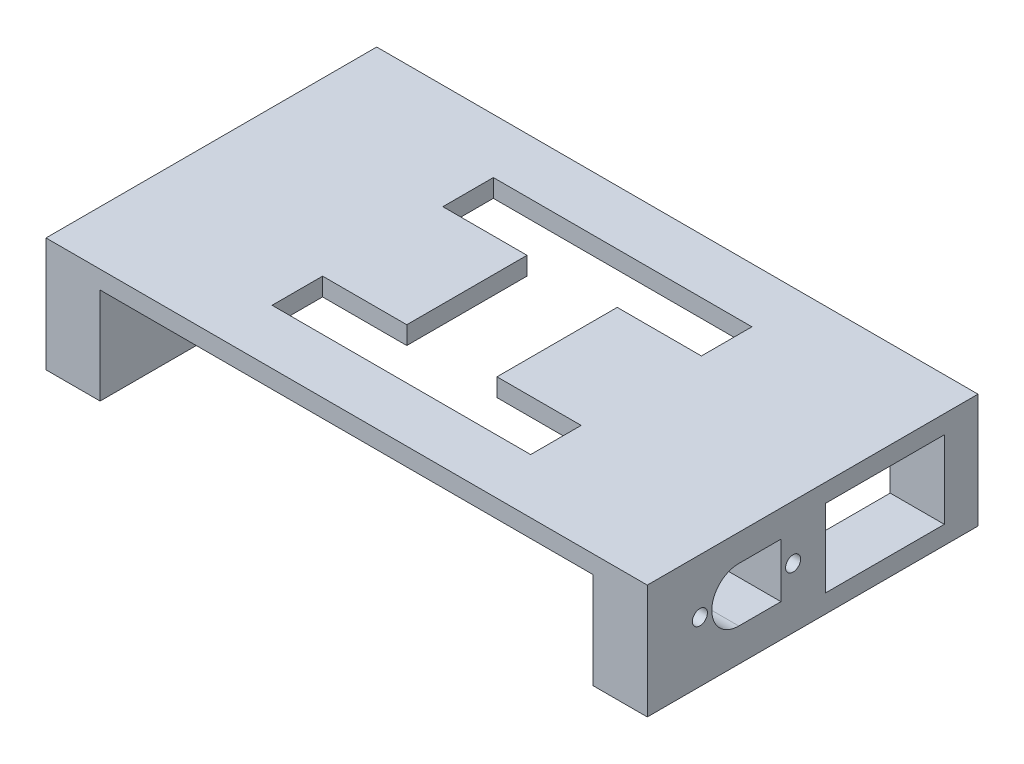
from build123d import *

# Parameters (mm, degrees)
SKETCH1_W           = 100
SKETCH1_H           = 55
BOSS_EXTRUDE1_DEPTH = 19
SKETCH2_W           = 82
SKETCH2_H           = 91
CUT_EXTRUDE1_DEPTH  = 16
CUT_EXTRUDE3_REACH  = 107.438
SKETCH3_R           = 1.25
CUT_EXTRUDE13_REACH = 107.438
SKETCH15_W          = 19.8
SKETCH15_H          = 12.9
CUT_EXTRUDE14_REACH = 62.144
SKETCH6_W           = 43
SKETCH6_H           = 8.4
CUT_EXTRUDE17_REACH = 62.144
SKETCH18_W          = 15
SKETCH18_H          = 20


with BuildPart() as part:
    # Sketch1 → Boss-Extrude1 (new body)
    with BuildSketch(Plane(origin=(0, 0, 0), x_dir=(1, 0, 0), z_dir=(0, 1, 0))):
        Rectangle(SKETCH1_W, SKETCH1_H)
    extrude(amount=BOSS_EXTRUDE1_DEPTH)

    # Sketch2 → Cut-Extrude1 (cut)
    with BuildSketch(Plane.XZ):
        Rectangle(SKETCH2_W, SKETCH2_H)
    extrude(amount=-CUT_EXTRUDE1_DEPTH, mode=Mode.SUBTRACT)

    # Sketch3 → Cut-Extrude3 (cut, up to next)
    with BuildSketch(Plane(origin=(50, 0, 0), x_dir=(0, 0, -1), z_dir=(1, 0, 0)), mode=Mode.PRIVATE) as cut_extrude3_sk1:
        with Locations((-18.75, 10)):
            Circle(SKETCH3_R)
    cut_extrude3_tool1 = extrude(cut_extrude3_sk1.sketch, amount=-CUT_EXTRUDE3_REACH, mode=Mode.PRIVATE) & part.part
    # Sketch3 → Cut-Extrude3 (cut, up to next)
    with BuildSketch(Plane(origin=(50, 0, 0), x_dir=(0, 0, -1), z_dir=(1, 0, 0)), mode=Mode.PRIVATE) as cut_extrude3_sk2:
        with Locations((-3.25, 10)):
            Circle(SKETCH3_R)
    cut_extrude3_tool2 = extrude(cut_extrude3_sk2.sketch, amount=-CUT_EXTRUDE3_REACH, mode=Mode.PRIVATE) & part.part
    # Sketch3 → Cut-Extrude3 (cut, up to next)
    with BuildSketch(Plane(origin=(50, 0, 0), x_dir=(0, 0, -1), z_dir=(1, 0, 0)), mode=Mode.PRIVATE) as cut_extrude3_sk3:
        with BuildLine():
            Line((-5.272727273, 5.5), (-5.272727273, 14.5))
            Line((-5.272727273, 14.5), (-12.278409091, 14.5))
            ThreePointArc((-12.278409091, 14.5), (-16.778409091, 10), (-12.278409091, 5.5))
            Line((-12.278409091, 5.5), (-5.272727273, 5.5))
        make_face()
    cut_extrude3_tool3 = extrude(cut_extrude3_sk3.sketch, amount=-CUT_EXTRUDE3_REACH, mode=Mode.PRIVATE) & part.part
    add(cut_extrude3_tool1.solids().sort_by_distance((50, 10, 18.75))[0], mode=Mode.SUBTRACT)
    add(cut_extrude3_tool2.solids().sort_by_distance((50, 10, 3.25))[0], mode=Mode.SUBTRACT)
    add(cut_extrude3_tool3.solids().sort_by_distance((50, 10, 10.590569))[0], mode=Mode.SUBTRACT)

    # Sketch15 → Cut-Extrude13 (cut, up to next)
    with BuildSketch(Plane(origin=(50, 0, 0), x_dir=(0, 0, -1), z_dir=(1, 0, 0)), mode=Mode.PRIVATE) as cut_extrude13_sk1:
        with Locations((12, 9.5)):
            Rectangle(SKETCH15_W, SKETCH15_H)
    cut_extrude13_tool1 = extrude(cut_extrude13_sk1.sketch, amount=-CUT_EXTRUDE13_REACH, mode=Mode.PRIVATE) & part.part
    add(cut_extrude13_tool1.solids().sort_by_distance((50, 9.5, -12))[0], mode=Mode.SUBTRACT)

    # Sketch6 → Cut-Extrude14 (cut, up to next)
    with BuildSketch(Plane(origin=(0, 19, 0), x_dir=(1, 0, 0), z_dir=(0, 1, 0)), mode=Mode.PRIVATE) as cut_extrude14_sk1:
        with Locations((0, -14.2)):
            Rectangle(SKETCH6_W, SKETCH6_H)
    cut_extrude14_tool1 = extrude(cut_extrude14_sk1.sketch, amount=-CUT_EXTRUDE14_REACH, mode=Mode.PRIVATE) & part.part
    # Sketch6 → Cut-Extrude14 (cut, up to next)
    with BuildSketch(Plane(origin=(0, 19, 0), x_dir=(1, 0, 0), z_dir=(0, 1, 0)), mode=Mode.PRIVATE) as cut_extrude14_sk2:
        with Locations((0, 14.2)):
            Rectangle(SKETCH6_W, SKETCH6_H)
    cut_extrude14_tool2 = extrude(cut_extrude14_sk2.sketch, amount=-CUT_EXTRUDE14_REACH, mode=Mode.PRIVATE) & part.part
    add(cut_extrude14_tool1.solids().sort_by_distance((0, 19, 14.2))[0], mode=Mode.SUBTRACT)
    add(cut_extrude14_tool2.solids().sort_by_distance((0, 19, -14.2))[0], mode=Mode.SUBTRACT)

    # Sketch18 → Cut-Extrude17 (cut, up to next)
    with BuildSketch(Plane(origin=(0, 19, 0), x_dir=(1, 0, 0), z_dir=(0, 1, 0)), mode=Mode.PRIVATE) as cut_extrude17_sk1:
        Rectangle(SKETCH18_W, SKETCH18_H)
    cut_extrude17_tool1 = extrude(cut_extrude17_sk1.sketch, amount=-CUT_EXTRUDE17_REACH, mode=Mode.PRIVATE) & part.part
    add(cut_extrude17_tool1.solids().sort_by_distance((0, 19, 0))[0], mode=Mode.SUBTRACT)


solid = part.part
